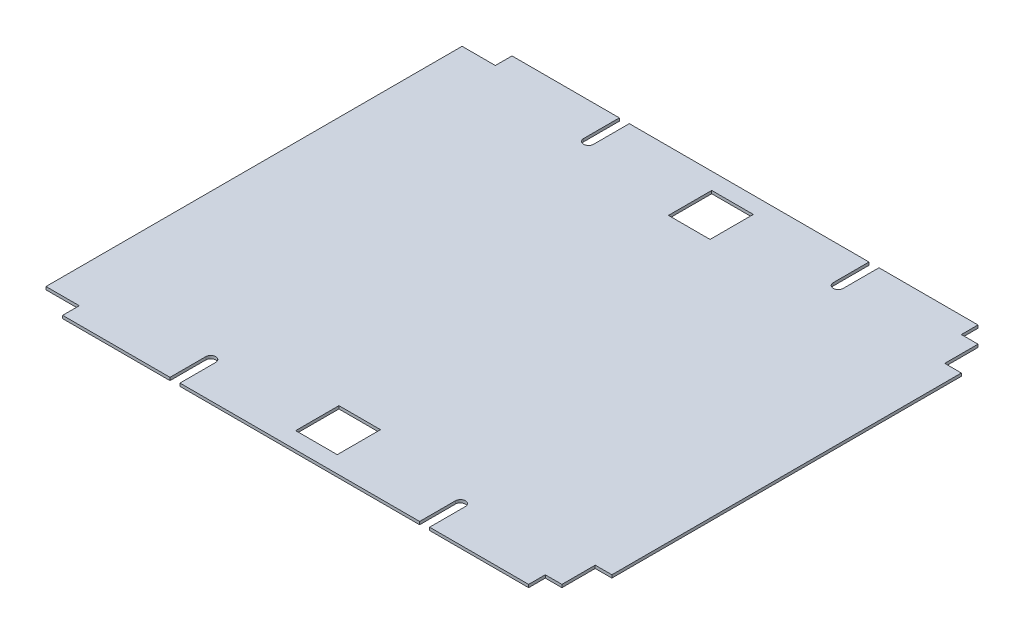
from build123d import *

# Parameters (mm, degrees)
BOSS_EXTRUDE1_DEPTH = 3.5
SKETCH2_W           = 50
SKETCH2_H           = 52
SKETCH2_W_2         = 20
SKETCH2_H_2         = 40
CUT_EXTRUDE1_DEPTH  = 10
CUT_EXTRUDE2_DEPTH  = 10


with BuildPart() as part:
    # Sketch1 → Boss-Extrude1 (new body)
    with BuildSketch(Plane(origin=(0, 0, 0), x_dir=(1, 0, 0), z_dir=(0, 1, 0))):
        Polygon((-280, 270), (280, 270), (280, 250), (320, 250), (320, -250), (280, -250), (280, -270), (-280, -270), (-280, -250), (-320, -250), (-320, 250), (-280, 250), align=None)
    extrude(amount=BOSS_EXTRUDE1_DEPTH)

    # Sketch2 → Cut-Extrude1 (cut)
    with BuildSketch(Plane(origin=(0, 3.5, 0), x_dir=(1, 0, 0), z_dir=(0, 1, 0))):
        with Locations((5, -224)):
            Rectangle(SKETCH2_W, SKETCH2_H)
        with Locations((5, 224)):
            Rectangle(SKETCH2_W, SKETCH2_H)
        with Locations((310, 230)):
            Rectangle(SKETCH2_W_2, SKETCH2_H_2)
        with Locations((310, -230)):
            Rectangle(SKETCH2_W_2, SKETCH2_H_2)
    extrude(amount=-CUT_EXTRUDE1_DEPTH, mode=Mode.SUBTRACT)

    # Sketch3 → Cut-Extrude2 (cut)
    with BuildSketch(Plane(origin=(0, 3.5, 0), x_dir=(1, 0, 0), z_dir=(0, 1, 0))):
        with BuildLine():
            Line((149, 227), (149, 270))
            Line((149, 270), (161, 270))
            Line((161, 270), (161, 227))
            ThreePointArc((161, 227), (155, 221), (149, 227))
        make_face()
        with BuildLine():
            Line((161, -227), (161, -270))
            Line((161, -270), (149, -270))
            Line((149, -270), (149, -227))
            ThreePointArc((149, -227), (155, -221), (161, -227))
        make_face()
        with BuildLine():
            Line((-139, -227), (-139, -270))
            Line((-139, -270), (-151, -270))
            Line((-151, -270), (-151, -227))
            ThreePointArc((-151, -227), (-145, -221), (-139, -227))
        make_face()
        with BuildLine():
            Line((-151, 227), (-151, 270))
            Line((-151, 270), (-139, 270))
            Line((-139, 270), (-139, 227))
            ThreePointArc((-139, 227), (-145, 221), (-151, 227))
        make_face()
    extrude(amount=-CUT_EXTRUDE2_DEPTH, mode=Mode.SUBTRACT)


solid = part.part
